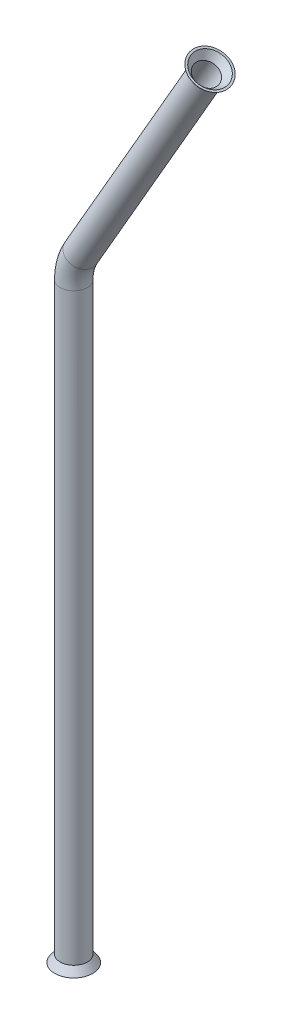
from build123d import *

# Parameters (mm, degrees)
SKETCH1_R           = 4.826
SKETCH1_R_2         = 4.064
SKETCH3_R           = 4.826
BOSS_EXTRUDE1_DEPTH = 2.54
BOSS_EXTRUDE1_DRAFT = -37
SKETCH5_R           = 4.826
BOSS_EXTRUDE2_DEPTH = 2.54
BOSS_EXTRUDE2_DRAFT = -37


with BuildPart() as part:
    # Sweep1: sweep along a path in Sketch2
    with BuildLine(Plane.XY) as sweep1_path:
        Line((0, 0), (0, 206.956941604))
        ThreePointArc((0, 206.956941604), (0.649113009, 211.887444413), (2.552216058, 216.481941604))
        Line((2.552216058, 216.481941604), (47.002216058, 293.4716))
    # Sketch1 → Sweep1 (sweep)
    with BuildSketch(Plane(origin=(0, 0, 0), x_dir=(1, 0, 0), z_dir=(0, 1, 0))):
        Circle(SKETCH1_R)
        Circle(SKETCH1_R_2, mode=Mode.SUBTRACT)
    sweep(path=sweep1_path.line)


with BuildPart() as boss_extrude1_tool:
    # Sketch3 → Boss-Extrude1 (with draft: the straight prism first)
    with BuildSketch(Plane.XZ):
        Circle(SKETCH3_R)
    extrude(amount=BOSS_EXTRUDE1_DEPTH)
    # Boss-Extrude1: the draft: its side faces are tilted about the plane it starts from
    boss_extrude1_sides = [boss_extrude1_tool.faces().sort_by_distance(p)[0] for p in [
        (-4.826, -1.27, 0),
    ]]
    draft(boss_extrude1_sides, Plane.XZ, BOSS_EXTRUDE1_DRAFT)


with BuildPart() as part_1:
    add(part.part)

    # Boss-Extrude1: add boss_extrude1_tool
    add(boss_extrude1_tool.part)

    # Cut-Extrude1 cone 1 section (through the dimple's axis) → Cut-Extrude1 (revolve, cut)
    with BuildSketch(Plane(origin=(0, -2.54, 0), x_dir=(0, 0, -1), z_dir=(1, 0, 0))):
        Polygon((0, 0), (5.978027287, 0), (0, 7.933110155), align=None)
    revolve(axis=Axis((0, -2.54, 0), (0, 1, 0)), mode=Mode.SUBTRACT)


with BuildPart() as boss_extrude2_tool:
    # Sketch5 → Boss-Extrude2 (with draft: the straight prism first)
    with BuildSketch(Plane(origin=(138.827484459, 240.45625657, 0), x_dir=(0, 0, -1), z_dir=(0.5000000000000009, 0.8660254037844383, 0))):
        with Locations((0, 106.03068686)):
            Circle(SKETCH5_R)
    extrude(amount=BOSS_EXTRUDE2_DEPTH)
    # Boss-Extrude2: the draft: its side faces are tilted about the plane it starts from
    boss_extrude2_sides = [boss_extrude2_tool.faces().sort_by_distance(p)[0] for p in [
        (47.637216058, 294.571452263, 4.826),
    ]]
    draft(boss_extrude2_sides, Plane(origin=(138.827484459, 240.45625657, 0), x_dir=(0, 0, -1), z_dir=(0.5000000000000009, 0.8660254037844383, 0)), BOSS_EXTRUDE2_DRAFT)


with BuildPart() as part_2:
    add(part_1.part)

    # Boss-Extrude2: add boss_extrude2_tool
    add(boss_extrude2_tool.part)

    # Cut-Extrude2 cone 1 section (through the dimple's axis) → Cut-Extrude2 (revolve, cut)
    with BuildSketch(Plane(origin=(48.272216058, 295.671304526, 0), x_dir=(0, 0, 1), z_dir=(0.866025404, -0.5, 0))):
        Polygon((0, 0), (5.978027287, 0), (0, 7.933110155), align=None)
    revolve(axis=Axis((48.272216058, 295.671304526, 0), (-0.5, -0.866025404, 0)), mode=Mode.SUBTRACT)


solid = part_2.part
